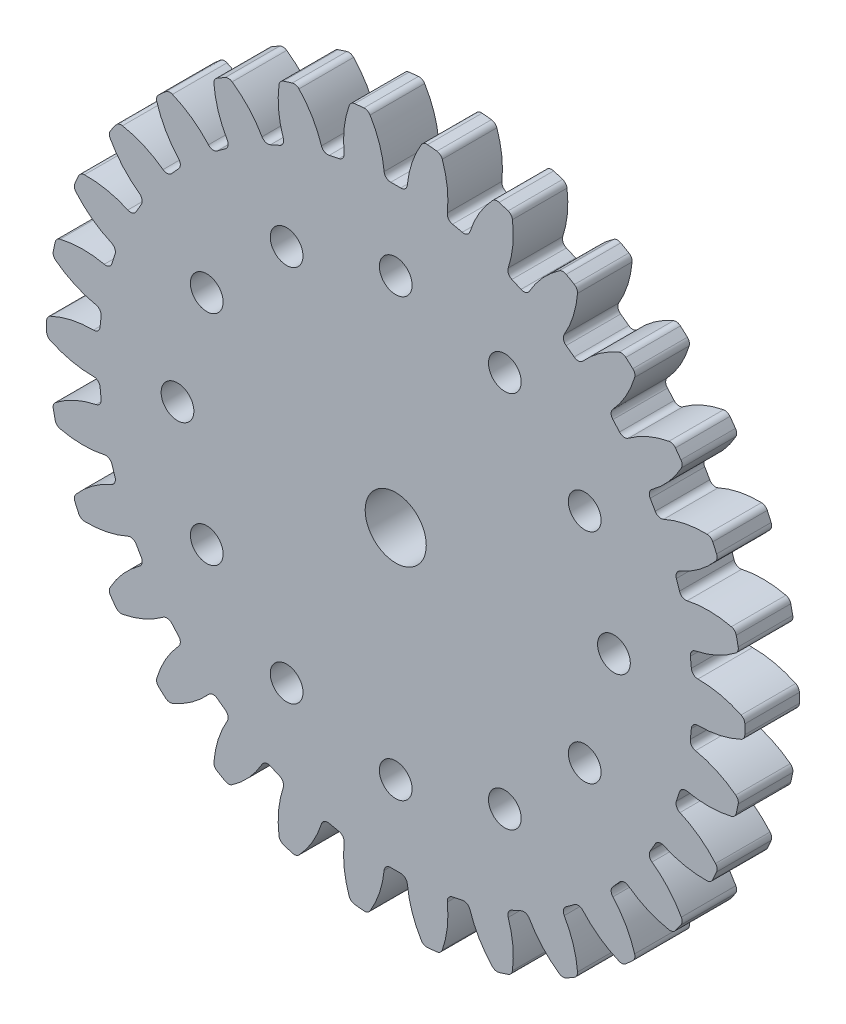
from build123d import *

# Parameters (mm, degrees)
SKETCH1_R                = 32
BOSS_EXTRUDE1_DEPTH      = 2.5
CUT_EXTRUDE1_DEPTH       = 5
FILLET1_R                = 0.6
CIRPATTERN1_COUNT        = 30
FILLET1_OF_CIRPATTERN1_R = 0.6
SKETCH23_R               = 3.25
CUT_EXTRUDE9_DEPTH       = 0.7
SKETCH24_R               = 4
CUT_EXTRUDE10_DEPTH      = 10
SKETCH25_R               = 4.603821227
BOSS_EXTRUDE2_DEPTH      = 5
SKETCH28_R               = 1.5
CUT_EXTRUDE11_DEPTH      = 46.438450134
SKETCH29_R               = 2.8
CUT_EXTRUDE12_DEPTH      = 50


with BuildPart() as part:
    # Sketch1 → Boss-Extrude1 (new, symmetric)
    with BuildSketch(Plane.XY):
        Circle(SKETCH1_R)
    extrude(amount=BOSS_EXTRUDE1_DEPTH, both=True)

    # Sketch3 → Cut-Extrude1 (cut)
    with BuildSketch(Plane.XY.offset(2.5)):
        with BuildLine():
            ThreePointArc((-3.269094679, 32.837676836), (-1.662330054, 30.201552778), (-1.025973716, 27.180643442))
            ThreePointArc((-1.025973716, 27.180643442), (0, 27.2), (1.025973716, 27.180643442))
            ThreePointArc((1.025973716, 27.180643442), (1.662330054, 30.201552778), (3.269094679, 32.837676836))
            ThreePointArc((3.269094679, 32.837676836), (0, 33), (-3.269094679, 32.837676836))
        make_face()
    cut_extrude1 = extrude(amount=-CUT_EXTRUDE1_DEPTH, mode=Mode.SUBTRACT)

    # Fillet1
    fillet1_edges = [part.edges().sort_by_distance(p)[0] for p in [
        (-2.551180945, 31.8981422, 0),
        (-1.025973716, 27.180643442, 0),
        (1.025973716, 27.180643442, 0),
        (2.551180945, 31.8981422, 0),
    ]]
    fillet(fillet1_edges, radius=FILLET1_R)

    # CirPattern1: Cut-Extrude1 ×30 about axis
    cirpattern1_axis = Axis((0, 0, 0), (0, 0, 1))
    for i in range(1, CIRPATTERN1_COUNT):
        add(cut_extrude1.rotate(cirpattern1_axis, i * 360 / CIRPATTERN1_COUNT), mode=Mode.SUBTRACT)

    # Fillet1 of CirPattern1
    fillet1_of_cirpattern1_edges = [part.edges().sort_by_distance(p)[0] for p in [
        (-9.127428199, 30.670670917, 0),
        (-6.654727264, 26.37336924, 0),
        (-4.647619807, 26.799993099, 0),
        (-4.136565159, 31.731511604, 0),
        (-15.304763042, 28.10274414, 0),
        (-11.992637298, 24.413452248, 0),
        (-10.118090043, 25.248054457, 0),
        (-10.643523515, 30.178061687, 0),
        (-20.8132063, 24.306592593, 0),
        (-16.806411535, 21.386550244, 0),
        (-15.146351192, 22.592654682, 0),
        (-16.685308821, 27.305685664, 0),
        (-25.41201257, 19.448126314, 0),
        (-20.885664942, 17.42495337, 0),
        (-19.512644113, 18.949847486, 0),
        (-21.997866066, 23.23992015, 0),
        (-28.900191951, 13.739683592, 0),
        (-24.05211457, 12.70180242, 0),
        (-23.026140854, 14.478841022, 0),
        (-26.349011006, 18.158458607, 0),
        (-31.125294264, 7.430750767, 0),
        (-26.167371377, 7.423521754, 0),
        (-25.533284749, 9.375039729, 0),
        (-29.548577729, 12.28338529, 0),
        (-31.990071863, 0.797058477, 0),
        (-27.138988489, 1.820797565, 0),
        (-26.924501578, 3.861504214, 0),
        (-31.456729815, 5.871469094, 0),
        (-31.456729815, -5.871469094, 0),
        (-26.924501578, -3.861504214, 0),
        (-27.138988489, -1.820797565, 0),
        (-31.990071863, -0.797058477, 0),
        (-29.548577729, -12.28338529, 0),
        (-25.533284749, -9.375039729, 0),
        (-26.167371377, -7.423521754, 0),
        (-31.125294264, -7.430750767, 0),
        (-26.349011006, -18.158458607, 0),
        (-23.026140854, -14.478841022, 0),
        (-24.05211457, -12.70180242, 0),
        (-28.900191951, -13.739683592, 0),
        (-21.997866066, -23.23992015, 0),
        (-19.512644113, -18.949847486, 0),
        (-20.885664942, -17.42495337, 0),
        (-25.41201257, -19.448126314, 0),
        (-16.685308821, -27.305685664, 0),
        (-15.146351192, -22.592654682, 0),
        (-16.806411535, -21.386550244, 0),
        (-20.8132063, -24.306592593, 0),
        (-10.643523515, -30.178061687, 0),
        (-10.118090043, -25.248054457, 0),
        (-11.992637298, -24.413452248, 0),
        (-15.304763042, -28.10274414, 0),
        (-4.136565159, -31.731511604, 0),
        (-4.647619807, -26.799993099, 0),
        (-6.654727264, -26.37336924, 0),
        (-9.127428199, -30.670670917, 0),
        (2.551180945, -31.8981422, 0),
        (1.025973716, -27.180643442, 0),
        (-1.025973716, -27.180643442, 0),
        (-2.551180945, -31.8981422, 0),
        (9.127428199, -30.670670917, 0),
        (6.654727264, -26.37336924, 0),
        (4.647619807, -26.799993099, 0),
        (4.136565159, -31.731511604, 0),
        (15.304763042, -28.10274414, 0),
        (11.992637298, -24.413452248, 0),
        (10.118090043, -25.248054457, 0),
        (10.643523515, -30.178061687, 0),
        (20.8132063, -24.306592593, 0),
        (16.806411535, -21.386550244, 0),
        (15.146351192, -22.592654682, 0),
        (16.685308821, -27.305685664, 0),
        (25.41201257, -19.448126314, 0),
        (20.885664942, -17.42495337, 0),
        (19.512644113, -18.949847486, 0),
        (21.997866066, -23.23992015, 0),
        (28.900191951, -13.739683592, 0),
        (24.05211457, -12.70180242, 0),
        (23.026140854, -14.478841022, 0),
        (26.349011006, -18.158458607, 0),
        (31.125294264, -7.430750767, 0),
        (26.167371377, -7.423521754, 0),
        (25.533284749, -9.375039729, 0),
        (29.548577729, -12.28338529, 0),
        (31.990071863, -0.797058477, 0),
        (27.138988489, -1.820797565, 0),
        (26.924501578, -3.861504214, 0),
        (31.456729815, -5.871469094, 0),
        (31.456729815, 5.871469094, 0),
        (26.924501578, 3.861504214, 0),
        (27.138988489, 1.820797565, 0),
        (31.990071863, 0.797058477, 0),
        (29.548577729, 12.28338529, 0),
        (25.533284749, 9.375039729, 0),
        (26.167371377, 7.423521754, 0),
        (31.125294264, 7.430750767, 0),
        (26.349011006, 18.158458607, 0),
        (23.026140854, 14.478841022, 0),
        (24.05211457, 12.70180242, 0),
        (28.900191951, 13.739683592, 0),
        (21.997866066, 23.23992015, 0),
        (19.512644113, 18.949847486, 0),
        (20.885664942, 17.42495337, 0),
        (25.41201257, 19.448126314, 0),
        (16.685308821, 27.305685664, 0),
        (15.146351192, 22.592654682, 0),
        (16.806411535, 21.386550244, 0),
        (20.8132063, 24.306592593, 0),
        (10.643523515, 30.178061687, 0),
        (10.118090043, 25.248054457, 0),
        (11.992637298, 24.413452248, 0),
        (15.304763042, 28.10274414, 0),
        (4.136565159, 31.731511604, 0),
        (4.647619807, 26.799993099, 0),
        (6.654727264, 26.37336924, 0),
        (9.127428199, 30.670670917, 0),
    ]]
    fillet(fillet1_of_cirpattern1_edges, radius=FILLET1_OF_CIRPATTERN1_R)

    # Sketch23 → Cut-Extrude9 (cut)
    with BuildSketch(Plane(origin=(0, 0, -2.5), x_dir=(-1, 0, 0), z_dir=(0, 0, -1))):
        Circle(SKETCH23_R)
    extrude(amount=-CUT_EXTRUDE9_DEPTH, mode=Mode.SUBTRACT)

    # Sketch24 → Cut-Extrude10 (cut)
    with BuildSketch(Plane.XY.offset(2.5)):
        Circle(SKETCH24_R)
    extrude(amount=-CUT_EXTRUDE10_DEPTH, mode=Mode.SUBTRACT)

    # Sketch25 → Boss-Extrude2 (add, through all)
    with BuildSketch(Plane.XY.offset(2.5)):
        Circle(SKETCH25_R)
    extrude(amount=-BOSS_EXTRUDE2_DEPTH)

    # Sketch28 → Cut-Extrude11 (cut, through all)
    with BuildSketch(Plane(origin=(0, 0, -2.5), x_dir=(-1, 0, 0), z_dir=(0, 0, -1))):
        with Locations((20, 0)):
            Circle(SKETCH28_R)
        with Locations((17.320508076, -10)):
            Circle(SKETCH28_R)
        with Locations((10, -17.320508076)):
            Circle(SKETCH28_R)
        with Locations((0, -20)):
            Circle(SKETCH28_R)
        with Locations((-10, -17.320508076)):
            Circle(SKETCH28_R)
        with Locations((-17.320508076, -10)):
            Circle(SKETCH28_R)
        with Locations((-20, 0)):
            Circle(SKETCH28_R)
        with Locations((-17.320508076, 10)):
            Circle(SKETCH28_R)
        with Locations((-10, 17.320508076)):
            Circle(SKETCH28_R)
        with Locations((0, 20)):
            Circle(SKETCH28_R)
        with Locations((10, 17.320508076)):
            Circle(SKETCH28_R)
        with Locations((17.320508076, 10)):
            Circle(SKETCH28_R)
    extrude(amount=-CUT_EXTRUDE11_DEPTH, mode=Mode.SUBTRACT)

    # Sketch29 → Cut-Extrude12 (cut)
    with BuildSketch(Plane(origin=(0, 0, -2.5), x_dir=(-1, 0, 0), z_dir=(0, 0, -1))):
        Circle(SKETCH29_R)
    extrude(amount=-CUT_EXTRUDE12_DEPTH, mode=Mode.SUBTRACT)


solid = part.part
